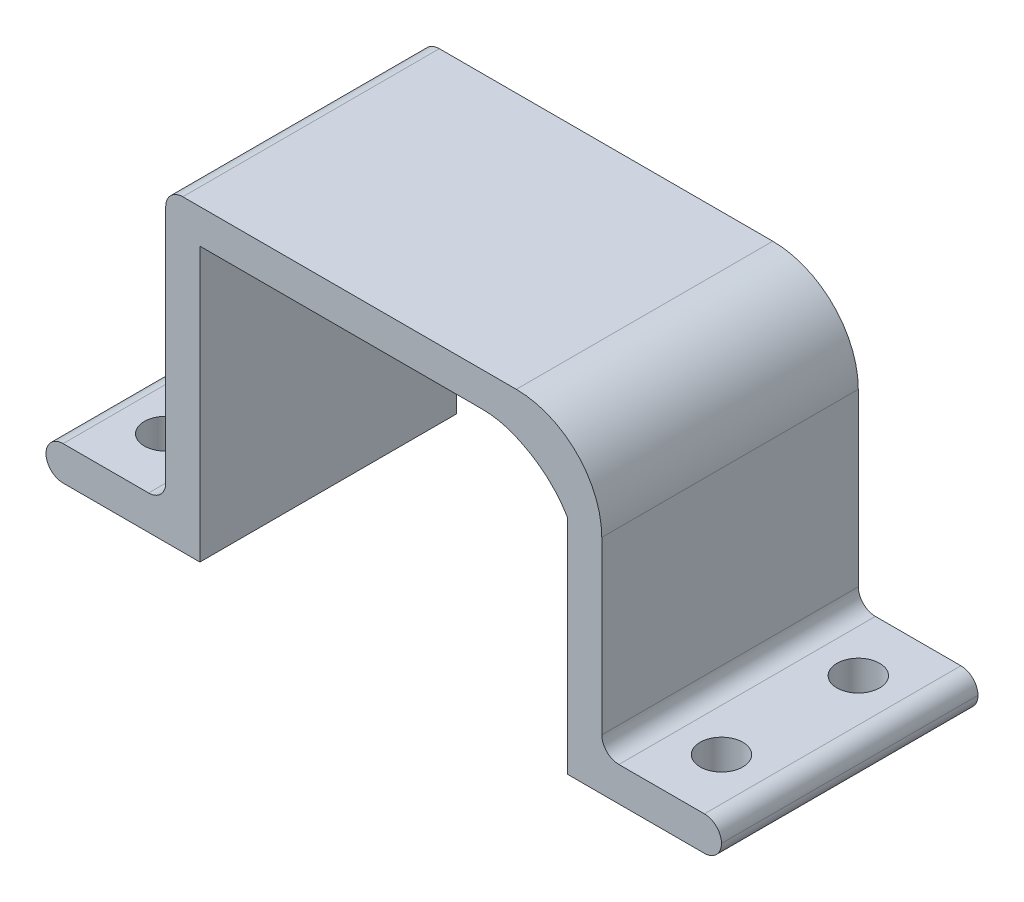
from build123d import *

# Parameters (mm, degrees)
BOSS_EXTRUDE1_DEPTH = 30
SKETCH2_R           = 2.5
CUT_EXTRUDE1_DEPTH  = 91.360389552
CUT_EXTRUDE2_DEPTH  = 92.853143659
FILLET1_R           = 2


with BuildPart() as part:
    # Sketch1 → Boss-Extrude1 (new body)
    with BuildSketch(Plane.XY):
        with BuildLine():
            Line((0, 0), (18, 0))
            Line((18, 0), (18, 32))
            Line((18, 32), (51, 32))
            ThreePointArc((51, 32), (58.071067812, 29.071067812), (61, 22))
            Line((61, 22), (61, 0))
            Line((61, 0), (79, 0))
            Line((79, 0), (79, 4))
            Line((79, 4), (65, 4))
            Line((65, 4), (65, 26))
            ThreePointArc((65, 26), (62.071067812, 33.071067812), (55, 36))
            Line((55, 36), (14, 36))
            Line((14, 36), (14, 4))
            Line((14, 4), (0, 4))
            Line((0, 4), (0, 0))
        make_face()
    extrude(amount=BOSS_EXTRUDE1_DEPTH)

    # Sketch2 → Cut-Extrude1 (cut, through all)
    with BuildSketch(Plane(origin=(0, 4, 0), x_dir=(1, 0, 0), z_dir=(0, 1, 0))):
        with Locations(Location((7, -7, 0), (0, 0, 270))):
            Circle(SKETCH2_R)
        with Locations(Location((7, -23, 0), (0, 0, 270))):
            Circle(SKETCH2_R)
        with Locations(Location((72, -7, 0), (0, 0, 270))):
            Circle(SKETCH2_R)
        with Locations(Location((72, -23, 0), (0, 0, 270))):
            Circle(SKETCH2_R)
    extrude(amount=-CUT_EXTRUDE1_DEPTH, mode=Mode.SUBTRACT)

    # Sketch3 → Cut-Extrude2 (cut, through all)
    with BuildSketch(Plane.XY.offset(30)):
        with BuildLine():
            ThreePointArc((55.768474142, 30.789860884), (59.593158366, 27.114452981), (61, 22))
            Line((61, 22), (61, 26.007623502))
            ThreePointArc((61, 26.007623502), (58.735019606, 28.782480547), (55.768474142, 30.789860884))
        make_face()
    extrude(amount=-CUT_EXTRUDE2_DEPTH, mode=Mode.SUBTRACT)

    # Fillet1
    fillet1_edges = [part.edges().sort_by_distance(p)[0] for p in [
        (79, 0, 15),
        (79, 4, 15),
        (65, 4, 15),
        (14, 36, 15),
        (0, 0, 15),
        (0, 4, 15),
        (14, 4, 15),
    ]]
    fillet(fillet1_edges, radius=FILLET1_R - 0.0001)  # a hair under: the kernel refuses the full size


solid = part.part
